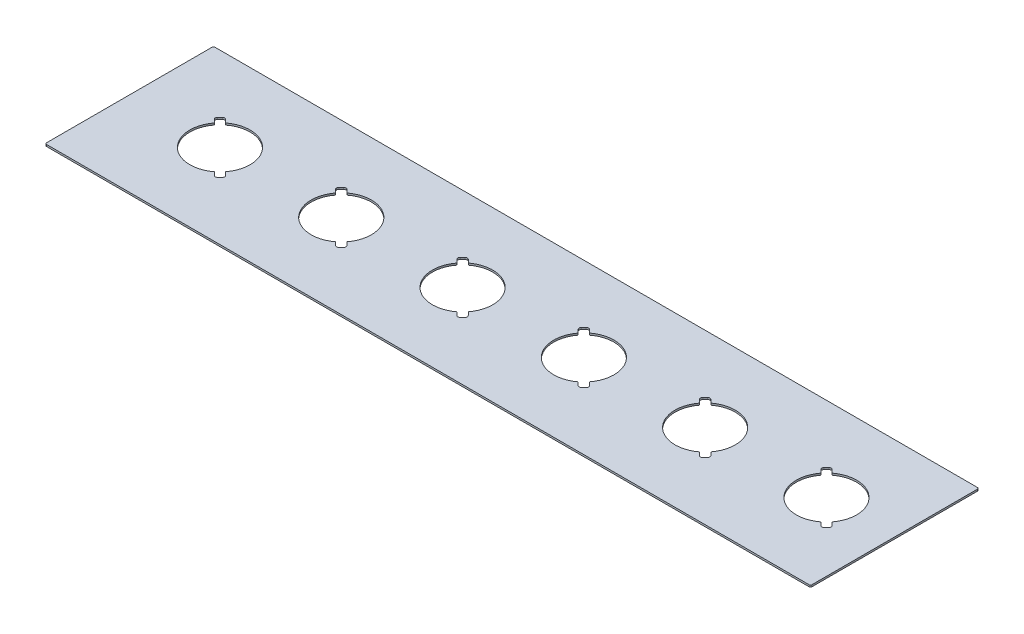
from build123d import *

# Parameters (mm, degrees)
SKETCH2_W           = 635
SKETCH2_H           = 139.7
BOSS_EXTRUDE1_DEPTH = 1.524
FILLET1_R           = 1.27


with BuildPart() as part:
    # Sketch2 → Boss-Extrude1 (new body)
    with BuildSketch(Plane(origin=(0, 0, 0), x_dir=(1, 0, 0), z_dir=(0, 1, 0))):
        Rectangle(SKETCH2_W, SKETCH2_H)
        with BuildLine():
            Line((180.148248211, -15.149432777), (182.79989864, -17.801083206))
            ThreePointArc((182.79989864, -17.801083206), (183.385685078, -19.215296769), (182.79989864, -20.629510331))
            Line((182.79989864, -20.629510331), (180.890710331, -22.53869864))
            ThreePointArc((180.890710331, -22.53869864), (179.476496769, -23.124485078), (178.062283206, -22.53869864))
            Line((178.062283206, -22.53869864), (175.410632777, -19.887048211))
            ThreePointArc((175.410632777, -19.887048211), (142.58353047, -17.67766953), (140.374151789, 15.149432777))
            Line((140.374151789, 15.149432777), (137.72250136, 17.801083206))
            ThreePointArc((137.72250136, 17.801083206), (137.136714922, 19.215296769), (137.72250136, 20.629510331))
            Line((137.72250136, 20.629510331), (139.631689669, 22.53869864))
            ThreePointArc((139.631689669, 22.53869864), (141.045903231, 23.124485078), (142.460116794, 22.53869864))
            Line((142.460116794, 22.53869864), (145.111767223, 19.887048211))
            ThreePointArc((145.111767223, 19.887048211), (177.93886953, 17.67766953), (180.148248211, -15.149432777))
        make_face(mode=Mode.SUBTRACT)
        with BuildLine():
            Line((243.094916794, 22.53869864), (245.746567223, 19.887048211))
            ThreePointArc((245.746567223, 19.887048211), (278.57366953, 17.67766953), (280.783048211, -15.149432777))
            Line((280.783048211, -15.149432777), (283.43469864, -17.801083206))
            ThreePointArc((283.43469864, -17.801083206), (284.020485078, -19.215296769), (283.43469864, -20.629510331))
            Line((283.43469864, -20.629510331), (281.525510331, -22.53869864))
            ThreePointArc((281.525510331, -22.53869864), (280.111296769, -23.124485078), (278.697083206, -22.53869864))
            Line((278.697083206, -22.53869864), (276.045432777, -19.887048211))
            ThreePointArc((276.045432777, -19.887048211), (243.21833047, -17.67766953), (241.008951789, 15.149432777))
            Line((241.008951789, 15.149432777), (238.35730136, 17.801083206))
            ThreePointArc((238.35730136, 17.801083206), (237.771514922, 19.215296769), (238.35730136, 20.629510331))
            Line((238.35730136, 20.629510331), (240.266489669, 22.53869864))
            ThreePointArc((240.266489669, 22.53869864), (241.680703231, 23.124485078), (243.094916794, 22.53869864))
        make_face(mode=Mode.SUBTRACT)
        with BuildLine():
            Line((39.739351789, 15.149432777), (37.08770136, 17.801083206))
            ThreePointArc((37.08770136, 17.801083206), (36.501914922, 19.215296769), (37.08770136, 20.629510331))
            Line((37.08770136, 20.629510331), (38.996889669, 22.53869864))
            ThreePointArc((38.996889669, 22.53869864), (40.411103231, 23.124485078), (41.825316794, 22.53869864))
            Line((41.825316794, 22.53869864), (44.476967223, 19.887048211))
            ThreePointArc((44.476967223, 19.887048211), (77.30406953, 17.67766953), (79.513448211, -15.149432777))
            Line((79.513448211, -15.149432777), (82.16509864, -17.801083206))
            ThreePointArc((82.16509864, -17.801083206), (82.750885078, -19.215296769), (82.16509864, -20.629510331))
            Line((82.16509864, -20.629510331), (80.255910331, -22.53869864))
            ThreePointArc((80.255910331, -22.53869864), (78.841696769, -23.124485078), (77.427483206, -22.53869864))
            Line((77.427483206, -22.53869864), (74.775832777, -19.887048211))
            ThreePointArc((74.775832777, -19.887048211), (41.94873047, -17.67766953), (39.739351789, 15.149432777))
        make_face(mode=Mode.SUBTRACT)
        with BuildLine():
            Line((-60.895448211, 15.149432777), (-63.54709864, 17.801083206))
            ThreePointArc((-63.54709864, 17.801083206), (-64.132885078, 19.215296769), (-63.54709864, 20.629510331))
            Line((-63.54709864, 20.629510331), (-61.637910331, 22.53869864))
            ThreePointArc((-61.637910331, 22.53869864), (-60.223696769, 23.124485078), (-58.809483206, 22.53869864))
            Line((-58.809483206, 22.53869864), (-56.157832777, 19.887048211))
            ThreePointArc((-56.157832777, 19.887048211), (-23.33073047, 17.67766953), (-21.121351789, -15.149432777))
            Line((-21.121351789, -15.149432777), (-18.46970136, -17.801083206))
            ThreePointArc((-18.46970136, -17.801083206), (-17.883914922, -19.215296769), (-18.46970136, -20.629510331))
            Line((-18.46970136, -20.629510331), (-20.378889669, -22.53869864))
            ThreePointArc((-20.378889669, -22.53869864), (-21.793103231, -23.124485078), (-23.207316794, -22.53869864))
            Line((-23.207316794, -22.53869864), (-25.858967223, -19.887048211))
            ThreePointArc((-25.858967223, -19.887048211), (-58.68606953, -17.67766953), (-60.895448211, 15.149432777))
        make_face(mode=Mode.SUBTRACT)
        with BuildLine():
            Line((-161.530248211, 15.149432777), (-164.18189864, 17.801083206))
            ThreePointArc((-164.18189864, 17.801083206), (-164.767685078, 19.215296769), (-164.18189864, 20.629510331))
            Line((-164.18189864, 20.629510331), (-162.272710331, 22.53869864))
            ThreePointArc((-162.272710331, 22.53869864), (-160.858496769, 23.124485078), (-159.444283206, 22.53869864))
            Line((-159.444283206, 22.53869864), (-156.792632777, 19.887048211))
            ThreePointArc((-156.792632777, 19.887048211), (-123.96553047, 17.67766953), (-121.756151789, -15.149432777))
            Line((-121.756151789, -15.149432777), (-119.10450136, -17.801083206))
            ThreePointArc((-119.10450136, -17.801083206), (-118.518714922, -19.215296769), (-119.10450136, -20.629510331))
            Line((-119.10450136, -20.629510331), (-121.013689669, -22.53869864))
            ThreePointArc((-121.013689669, -22.53869864), (-122.427903231, -23.124485078), (-123.842116794, -22.53869864))
            Line((-123.842116794, -22.53869864), (-126.493767223, -19.887048211))
            ThreePointArc((-126.493767223, -19.887048211), (-159.32086953, -17.67766953), (-161.530248211, 15.149432777))
        make_face(mode=Mode.SUBTRACT)
        with BuildLine():
            Line((-222.390951789, -15.149432777), (-219.73930136, -17.801083206))
            ThreePointArc((-219.73930136, -17.801083206), (-219.153514922, -19.215296769), (-219.73930136, -20.629510331))
            Line((-219.73930136, -20.629510331), (-221.648489669, -22.53869864))
            ThreePointArc((-221.648489669, -22.53869864), (-223.062703231, -23.124485078), (-224.476916794, -22.53869864))
            Line((-224.476916794, -22.53869864), (-227.128567223, -19.887048211))
            ThreePointArc((-227.128567223, -19.887048211), (-259.95566953, -17.67766953), (-262.165048211, 15.149432777))
            Line((-262.165048211, 15.149432777), (-264.81669864, 17.801083206))
            ThreePointArc((-264.81669864, 17.801083206), (-265.402485078, 19.215296769), (-264.81669864, 20.629510331))
            Line((-264.81669864, 20.629510331), (-262.907510331, 22.53869864))
            ThreePointArc((-262.907510331, 22.53869864), (-261.493296769, 23.124485078), (-260.079083206, 22.53869864))
            Line((-260.079083206, 22.53869864), (-257.427432777, 19.887048211))
            ThreePointArc((-257.427432777, 19.887048211), (-224.60033047, 17.67766953), (-222.390951789, -15.149432777))
        make_face(mode=Mode.SUBTRACT)
    extrude(amount=BOSS_EXTRUDE1_DEPTH)

    # Fillet1
    fillet1_edges = [part.edges().sort_by_distance(p)[0] for p in [
        (317.5, 0.762, -69.85),
        (317.5, 0.762, 69.85),
        (-317.5, 0.762, 69.85),
        (-317.5, 0.762, -69.85),
    ]]
    fillet(fillet1_edges, radius=FILLET1_R)


solid = part.part
